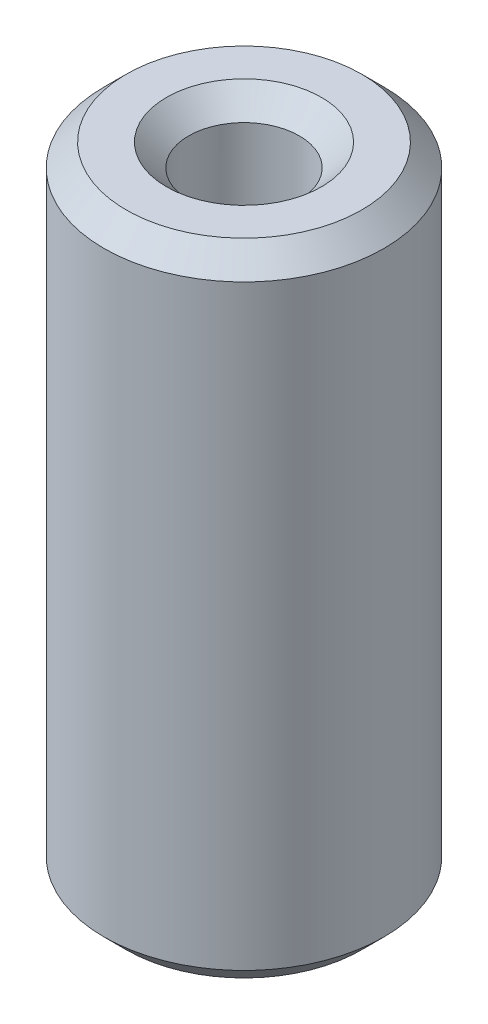
from build123d import *

# Parameters (mm, degrees)
SKETCH1_R           = 10
BOSS_EXTRUDE1_DEPTH = 45.795118928
SKETCH2_R           = 3.952364467
CUT_EXTRUDE1_DEPTH  = 48.929040442
CHAMFER1_SIZE       = 1.587918864


with BuildPart() as part:
    # Sketch1 → Boss-Extrude1 (new body)
    with BuildSketch(Plane(origin=(0, 0, 0), x_dir=(1, 0, 0), z_dir=(0, 1, 0))):
        Circle(SKETCH1_R)
    extrude(amount=BOSS_EXTRUDE1_DEPTH)

    # Sketch2 → Cut-Extrude1 (cut, through all)
    with BuildSketch(Plane(origin=(0, 0, 0), x_dir=(1, 0, 0), z_dir=(0, 1, 0))):
        Circle(SKETCH2_R)
    extrude(amount=CUT_EXTRUDE1_DEPTH, mode=Mode.SUBTRACT)

    # Chamfer1
    chamfer1_edges = [part.edges().sort_by_distance(p)[0] for p in [
        (-3.952364467, 45.795118928, 0),
        (-3.952364467, 0, 0),
        (-10, 0, 0),
        (-10, 45.795118928, 0),
    ]]
    chamfer(chamfer1_edges, length=CHAMFER1_SIZE)


solid = part.part
